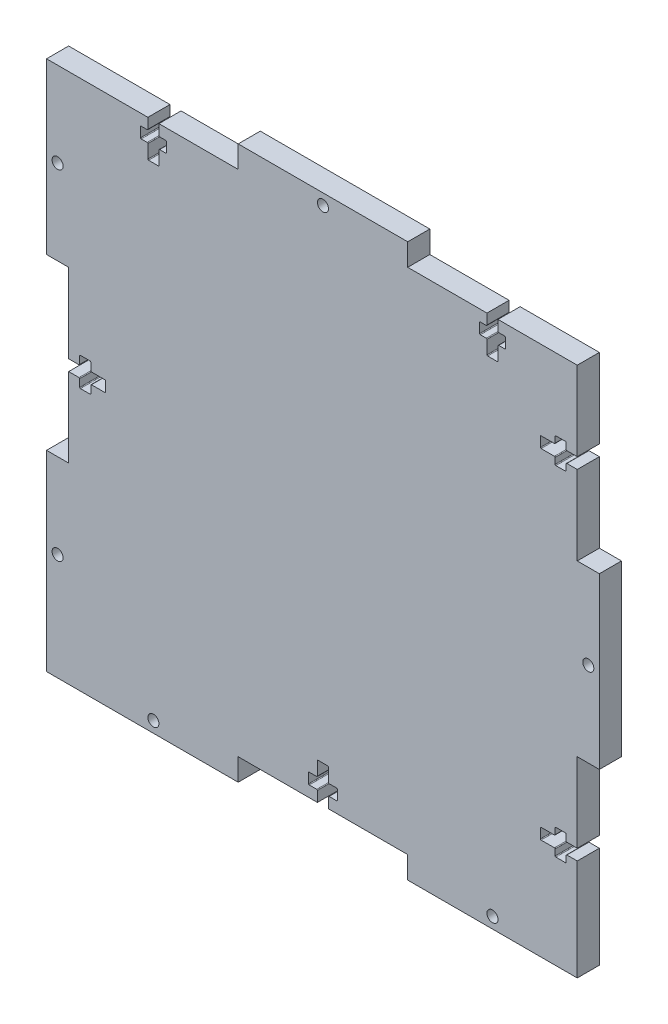
from build123d import *

# Parameters (mm, degrees)
BOX_SIDE_DEPTH       = 6
SKETCH2_R            = 1.5
SCREW_CUT_OUTS_DEPTH = 107.235587258


with BuildPart() as part:
    # Sketch1 → Box Side (new body)
    with BuildSketch(Plane.XY):
        Polygon((-69, 69), (-23, 69), (-23, 75), (23, 75), (23, 69), (69, 69), (69, 23), (75, 23), (75, -23), (69, -23), (69, -69), (69, -75), (23, -75), (23, -69), (-23, -69), (-23, -75), (-69, -75), (-75, -75), (-75, -69), (-75, -23), (-69, -23), (-69, 23), (-75, 23), (-75, 69), align=None)
    extrude(amount=BOX_SIDE_DEPTH)

    # Sketch2 → Screw Cut-outs (cut, through all)
    with BuildSketch(Plane.XY.offset(6)):
        with Locations((0, 72)):
            Circle(SKETCH2_R)
        with Locations((72, 0)):
            Circle(SKETCH2_R)
        with Locations((-46, -72)):
            Circle(SKETCH2_R)
        with Locations((46, -72)):
            Circle(SKETCH2_R)
        with Locations((-72, 46)):
            Circle(SKETCH2_R)
        with Locations((-72, -46)):
            Circle(SKETCH2_R)
        with BuildLine():
            Line((-44.5, 69), (-44.5, 66.2))
            ThreePointArc((-44.5, 66.2), (-44.441421356, 66.058578644), (-44.3, 66))
            Line((-44.3, 66), (-42.7, 66))
            ThreePointArc((-42.7, 66), (-42.558578644, 65.941421356), (-42.5, 65.8))
            Line((-42.5, 65.8), (-42.5, 63.2))
            ThreePointArc((-42.5, 63.2), (-42.558578644, 63.058578644), (-42.7, 63))
            Line((-42.7, 63), (-44.3, 63))
            ThreePointArc((-44.3, 63), (-44.441421356, 62.941421356), (-44.5, 62.8))
            Line((-44.5, 62.8), (-44.5, 59.2))
            ThreePointArc((-44.5, 59.2), (-44.558578644, 59.058578644), (-44.7, 59))
            Line((-44.7, 59), (-47.3, 59))
            ThreePointArc((-47.3, 59), (-47.441421356, 59.058578644), (-47.5, 59.2))
            Line((-47.5, 59.2), (-47.5, 62.8))
            ThreePointArc((-47.5, 62.8), (-47.558578644, 62.941421356), (-47.7, 63))
            Line((-47.7, 63), (-49.3, 63))
            ThreePointArc((-49.3, 63), (-49.441421356, 63.058578644), (-49.5, 63.2))
            Line((-49.5, 63.2), (-49.5, 65.8))
            ThreePointArc((-49.5, 65.8), (-49.441421356, 65.941421356), (-49.3, 66))
            Line((-49.3, 66), (-47.7, 66))
            ThreePointArc((-47.7, 66), (-47.558578644, 66.058578644), (-47.5, 66.2))
            Line((-47.5, 66.2), (-47.5, 69))
            Line((-47.5, 69), (-44.5, 69))
        make_face()
        with BuildLine():
            Line((47.5, 69), (47.5, 66.2))
            ThreePointArc((47.5, 66.2), (47.558578644, 66.058578644), (47.7, 66))
            Line((47.7, 66), (49.3, 66))
            ThreePointArc((49.3, 66), (49.441421356, 65.941421356), (49.5, 65.8))
            Line((49.5, 65.8), (49.5, 63.2))
            ThreePointArc((49.5, 63.2), (49.441421356, 63.058578644), (49.3, 63))
            Line((49.3, 63), (47.7, 63))
            ThreePointArc((47.7, 63), (47.558578644, 62.941421356), (47.5, 62.8))
            Line((47.5, 62.8), (47.5, 59.2))
            ThreePointArc((47.5, 59.2), (47.441421356, 59.058578644), (47.3, 59))
            Line((47.3, 59), (44.7, 59))
            ThreePointArc((44.7, 59), (44.558578644, 59.058578644), (44.5, 59.2))
            Line((44.5, 59.2), (44.5, 62.8))
            ThreePointArc((44.5, 62.8), (44.441421356, 62.941421356), (44.3, 63))
            Line((44.3, 63), (42.7, 63))
            ThreePointArc((42.7, 63), (42.558578644, 63.058578644), (42.5, 63.2))
            Line((42.5, 63.2), (42.5, 65.8))
            ThreePointArc((42.5, 65.8), (42.558578644, 65.941421356), (42.7, 66))
            Line((42.7, 66), (44.3, 66))
            ThreePointArc((44.3, 66), (44.441421356, 66.058578644), (44.5, 66.2))
            Line((44.5, 66.2), (44.5, 69))
            Line((44.5, 69), (47.5, 69))
        make_face()
        with BuildLine():
            Line((69, 44.5), (66.2, 44.5))
            ThreePointArc((66.2, 44.5), (66.058578644, 44.441421356), (66, 44.3))
            Line((66, 44.3), (66, 42.7))
            ThreePointArc((66, 42.7), (65.941421356, 42.558578644), (65.8, 42.5))
            Line((65.8, 42.5), (63.2, 42.5))
            ThreePointArc((63.2, 42.5), (63.058578644, 42.558578644), (63, 42.7))
            Line((63, 42.7), (63, 44.3))
            ThreePointArc((63, 44.3), (62.941421356, 44.441421356), (62.8, 44.5))
            Line((62.8, 44.5), (59.2, 44.5))
            ThreePointArc((59.2, 44.5), (59.058578644, 44.558578644), (59, 44.7))
            Line((59, 44.7), (59, 47.3))
            ThreePointArc((59, 47.3), (59.058578644, 47.441421356), (59.2, 47.5))
            Line((59.2, 47.5), (62.8, 47.5))
            ThreePointArc((62.8, 47.5), (62.941421356, 47.558578644), (63, 47.7))
            Line((63, 47.7), (63, 49.3))
            ThreePointArc((63, 49.3), (63.058578644, 49.441421356), (63.2, 49.5))
            Line((63.2, 49.5), (65.8, 49.5))
            ThreePointArc((65.8, 49.5), (65.941421356, 49.441421356), (66, 49.3))
            Line((66, 49.3), (66, 47.7))
            ThreePointArc((66, 47.7), (66.058578644, 47.558578644), (66.2, 47.5))
            Line((66.2, 47.5), (69, 47.5))
            Line((69, 47.5), (69, 44.5))
        make_face()
        with BuildLine():
            Line((69, -47.5), (66.2, -47.5))
            ThreePointArc((66.2, -47.5), (66.058578644, -47.558578644), (66, -47.7))
            Line((66, -47.7), (66, -49.3))
            ThreePointArc((66, -49.3), (65.941421356, -49.441421356), (65.8, -49.5))
            Line((65.8, -49.5), (63.2, -49.5))
            ThreePointArc((63.2, -49.5), (63.058578644, -49.441421356), (63, -49.3))
            Line((63, -49.3), (63, -47.7))
            ThreePointArc((63, -47.7), (62.941421356, -47.558578644), (62.8, -47.5))
            Line((62.8, -47.5), (59.2, -47.5))
            ThreePointArc((59.2, -47.5), (59.058578644, -47.441421356), (59, -47.3))
            Line((59, -47.3), (59, -44.7))
            ThreePointArc((59, -44.7), (59.058578644, -44.558578644), (59.2, -44.5))
            Line((59.2, -44.5), (62.8, -44.5))
            ThreePointArc((62.8, -44.5), (62.941421356, -44.441421356), (63, -44.3))
            Line((63, -44.3), (63, -42.7))
            ThreePointArc((63, -42.7), (63.058578644, -42.558578644), (63.2, -42.5))
            Line((63.2, -42.5), (65.8, -42.5))
            ThreePointArc((65.8, -42.5), (65.941421356, -42.558578644), (66, -42.7))
            Line((66, -42.7), (66, -44.3))
            ThreePointArc((66, -44.3), (66.058578644, -44.441421356), (66.2, -44.5))
            Line((66.2, -44.5), (69, -44.5))
            Line((69, -44.5), (69, -47.5))
        make_face()
        with BuildLine():
            Line((-1.5, -69), (1.5, -69))
            Line((1.5, -69), (1.5, -66.2))
            ThreePointArc((1.5, -66.2), (1.558578644, -66.058578644), (1.7, -66))
            Line((1.7, -66), (3.7, -66))
            ThreePointArc((3.7, -66), (3.841421356, -65.941421356), (3.9, -65.8))
            Line((3.9, -65.8), (3.9, -63.2))
            ThreePointArc((3.9, -63.2), (3.841421356, -63.058578644), (3.7, -63))
            Line((3.7, -63), (1.7, -63))
            ThreePointArc((1.7, -63), (1.558578644, -62.941421356), (1.5, -62.8))
            Line((1.5, -62.8), (1.5, -59.2))
            ThreePointArc((1.5, -59.2), (1.441421356, -59.058578644), (1.3, -59))
            Line((1.3, -59), (-1.3, -59))
            ThreePointArc((-1.3, -59), (-1.441421356, -59.058578644), (-1.5, -59.2))
            Line((-1.5, -59.2), (-1.5, -62.8))
            ThreePointArc((-1.5, -62.8), (-1.558578644, -62.941421356), (-1.7, -63))
            Line((-1.7, -63), (-3.7, -63))
            ThreePointArc((-3.7, -63), (-3.841421356, -63.058578644), (-3.9, -63.2))
            Line((-3.9, -63.2), (-3.9, -65.8))
            ThreePointArc((-3.9, -65.8), (-3.841421356, -65.941421356), (-3.7, -66))
            Line((-3.7, -66), (-1.7, -66))
            ThreePointArc((-1.7, -66), (-1.558578644, -66.058578644), (-1.5, -66.2))
            Line((-1.5, -66.2), (-1.5, -69))
        make_face()
        with BuildLine():
            Line((-69, -1.5), (-66.2, -1.5))
            ThreePointArc((-66.2, -1.5), (-66.058578644, -1.558578644), (-66, -1.7))
            Line((-66, -1.7), (-66, -3.7))
            ThreePointArc((-66, -3.7), (-65.941421356, -3.841421356), (-65.8, -3.9))
            Line((-65.8, -3.9), (-63.2, -3.9))
            ThreePointArc((-63.2, -3.9), (-63.058578644, -3.841421356), (-63, -3.7))
            Line((-63, -3.7), (-63, -1.7))
            ThreePointArc((-63, -1.7), (-62.941421356, -1.558578644), (-62.8, -1.5))
            Line((-62.8, -1.5), (-59.2, -1.5))
            ThreePointArc((-59.2, -1.5), (-59.058578644, -1.441421356), (-59, -1.3))
            Line((-59, -1.3), (-59, 1.3))
            ThreePointArc((-59, 1.3), (-59.058578644, 1.441421356), (-59.2, 1.5))
            Line((-59.2, 1.5), (-62.8, 1.5))
            ThreePointArc((-62.8, 1.5), (-62.941421356, 1.558578644), (-63, 1.7))
            Line((-63, 1.7), (-63, 3.7))
            ThreePointArc((-63, 3.7), (-63.058578644, 3.841421356), (-63.2, 3.9))
            Line((-63.2, 3.9), (-65.8, 3.9))
            ThreePointArc((-65.8, 3.9), (-65.941421356, 3.841421356), (-66, 3.7))
            Line((-66, 3.7), (-66, 1.7))
            ThreePointArc((-66, 1.7), (-66.058578644, 1.558578644), (-66.2, 1.5))
            Line((-66.2, 1.5), (-69, 1.5))
            Line((-69, 1.5), (-69, -1.5))
        make_face()
    extrude(amount=-SCREW_CUT_OUTS_DEPTH, mode=Mode.SUBTRACT)


solid = part.part
